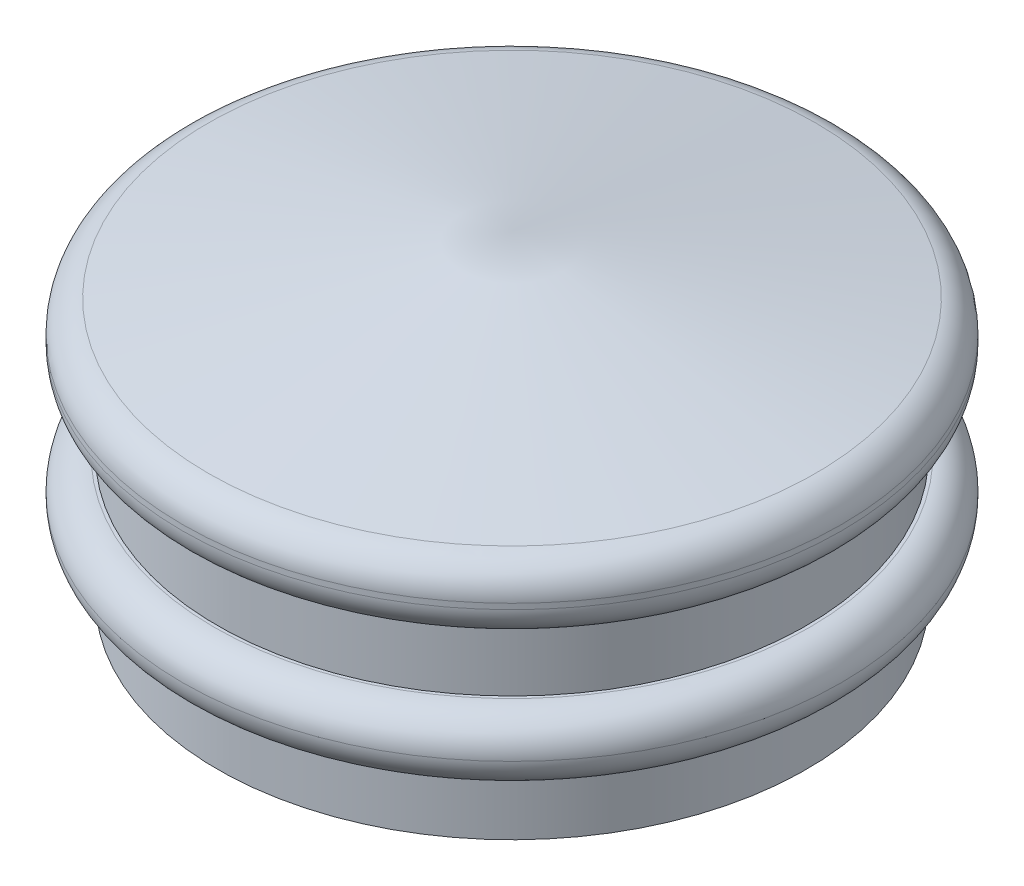
from build123d import *

# Parameters (mm, degrees)
FILLET1_R = 0.75


with BuildPart() as part:
    # Sketch1 → Revolve1 (revolve)
    with BuildSketch(Plane.XY, mode=Mode.PRIVATE) as revolve1_sk:
        Polygon((0, 7.5), (-7.75, 6.018214298), (-7.75, 4.518214298), (-6.927372109, 4.518214298), (-6.927372109, 2.927787826), (-7.75, 2.927787826), (-7.75, 1.427787826), (-6.927372109, 1.427787826), (-6.927372109, 0), (-5.136257755, 0), (-3.126714823, 1.427787826), (-3.126714823, 4.7), (0, 4.7), align=None)
    revolve(revolve1_sk.sketch.rotate(Axis((0, 0, 0), (0, 1, 0)), 270), axis=Axis((0, 0, 0), (0, 1, 0)))

    # Fillet1
    fillet1_edges = [part.edges().sort_by_distance(p)[0] for p in [
        (0, 6.018214298, 7.75),
        (0, 4.518214298, 7.75),
        (0, 2.927787826, 7.75),
        (0, 1.427787826, 7.75),
    ]]
    fillet(fillet1_edges, radius=FILLET1_R - 0.0001)  # a hair under: the kernel refuses the full size


solid = part.part
